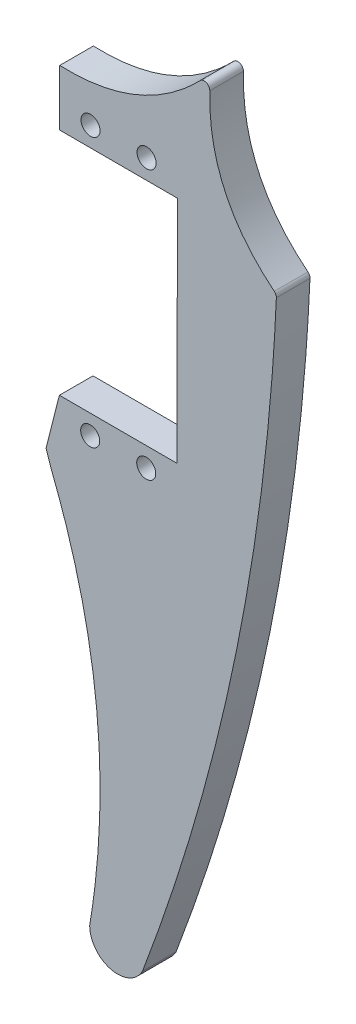
from build123d import *

# Parameters (mm, degrees)
SKETCH1_W           = 50
SKETCH1_H           = 146
BOSS_EXTRUDE1_DEPTH = 6
SKETCH3_W           = 50
SKETCH3_H           = 146
SKETCH3_R           = 1.7
CUT_EXTRUDE1_DEPTH  = 78.395090284


with BuildPart() as part:
    # Sketch1 → Boss-Extrude1 (new body)
    with BuildSketch(Plane.XY):
        Rectangle(SKETCH1_W, SKETCH1_H)
    extrude(amount=BOSS_EXTRUDE1_DEPTH)

    # Sketch3 → Cut-Extrude1 (cut, through all)
    # profile 1 of 5: a face of its own
    with BuildSketch(Plane.XY.offset(6)):
        Rectangle(SKETCH3_W, SKETCH3_H)
        with BuildLine():
            Line((-18.169843297, 52.461114738), (-18.157666585, 62.461107324))
            add(Edge.make_bspline(
                [(-18.157666585, 62.461107324), (-16.595787428, 62.40054525), (-13.772759201, 62.464261258), (-9.697592278, 63.074582136), (-6.3235109, 64.014176015), (-3.330757616, 65.219156255), (-0.94481153, 66.454321846), (1.113119903, 67.745229422), (3.761030335, 69.658518488), (5.631814544, 71.346079367), (6.900295351, 72.653402178)],
                knots=[0, 0, 0, 0, 0.167942372, 0.302841242, 0.441808799, 0.543310726, 0.649111052, 0.730099181, 0.804199887, 1, 1, 1, 1], degree=3))
            ThreePointArc((6.900295351, 72.653402178), (8.006083211, 72.878510262), (8.617522303, 71.930046937))
            add(Edge.make_bspline(
                [(8.617522303, 71.930046937), (8.590710324, 70.931587333), (8.616247935, 68.508726225), (8.97509159, 65.334163001), (9.675355593, 62.166917416), (10.407826162, 59.878461992), (11.375637803, 57.567082564), (12.476705695, 55.420888781), (13.985734658, 53.073760845), (15.699091005, 50.90924769), (17.727100256, 48.757794454), (19.223608489, 47.429602703), (20.123317244, 46.701792855)],
                knots=[0, 0, 0, 0, 0.10400348, 0.252210124, 0.331596335, 0.441573044, 0.501852928, 0.592428261, 0.692389888, 0.791956146, 0.879471991, 1, 1, 1, 1], degree=3))
            ThreePointArc((20.123317244, 46.701792855), (20.406083271, 46.335184873), (20.493418189, 45.880508448))
            add(Edge.make_bspline(
                [(-3.386129771, -70.119728338), (-2.21747594, -67.029455897), (-0.182430908, -61.43213239), (2.320638839, -54.010869169), (4.39612593, -47.471958806), (6.084233389, -41.826754396), (7.773371334, -35.827923865), (9.314485553, -30.006285299), (10.847177653, -23.777350088), (12.248531309, -17.633995633), (13.38184099, -12.246243723), (14.445923409, -6.813215488), (15.450948646, -1.273466268), (16.541323936, 5.397802811), (17.525796818, 12.227452617), (18.318292736, 18.577526245), (18.968243317, 24.556005739), (19.546819221, 30.747357743), (20.091144312, 37.979656821), (20.373774924, 43.153327808), (20.493418189, 45.880508448)],
                knots=[0, 0, 0, 0, 0.083335097, 0.150214343, 0.197536109, 0.256374009, 0.298827669, 0.354728647, 0.408266597, 0.460622921, 0.513659664, 0.547132194, 0.600265327, 0.655665944, 0.717630207, 0.774302923, 0.817071636, 0.86931356, 0.9311449, 1, 1, 1, 1], degree=3))
            ThreePointArc((-3.386129771, -70.119728338), (-9.012812454, -72.656301077), (-12.816272335, -67.795493305))
            add(Edge.make_bspline(
                [(-20.602879389, 2.095244868), (-20.020523896, 0.117608734), (-18.597491452, -3.334331588), (-16.904181184, -8.263198364), (-15.595665152, -12.546131745), (-14.456132729, -16.810408344), (-13.502980015, -20.975707084), (-12.475078727, -26.375577077), (-11.593046993, -32.660410116), (-10.802512336, -42.889860589), (-11.008756714, -54.642065179), (-12.153104447, -63.838427604), (-12.816272335, -67.795493305)],
                knots=[0, 0, 0, 0, 0.086646204, 0.157135059, 0.219373113, 0.275194629, 0.342966262, 0.399251523, 0.506628072, 0.609997758, 0.831095498, 1, 1, 1, 1], degree=3))
            Line((-20.602879389, 2.095244868), (-18.219767816, 11.461145134))
            Line((-18.219767816, 11.461145134), (2.780216616, 11.435574039))
            Line((2.780216616, 11.435574039), (2.830141135, 52.435543643))
            Line((2.830141135, 52.435543643), (-18.169843297, 52.461114738))
        make_face(mode=Mode.SUBTRACT)
    # profile 2 of 5: a face of its own
    with BuildSketch(Plane.XY.offset(6)):
        with Locations((-12.724033742, 7.954450537)):
            Circle(SKETCH3_R)
    # profile 3 of 5: a face of its own
    with BuildSketch(Plane.XY.offset(6)):
        with Locations((-2.724041156, 7.942273825)):
            Circle(SKETCH3_R)
    # profile 4 of 5: a face of its own
    with BuildSketch(Plane.XY.offset(6)):
        with Locations((-12.665585525, 55.954414952)):
            Circle(SKETCH3_R)
    # profile 5 of 5: a face of its own
    with BuildSketch(Plane.XY.offset(6)):
        with Locations((-2.665592939, 55.94223824)):
            Circle(SKETCH3_R)
    extrude(amount=-CUT_EXTRUDE1_DEPTH, mode=Mode.SUBTRACT)


solid = part.part
